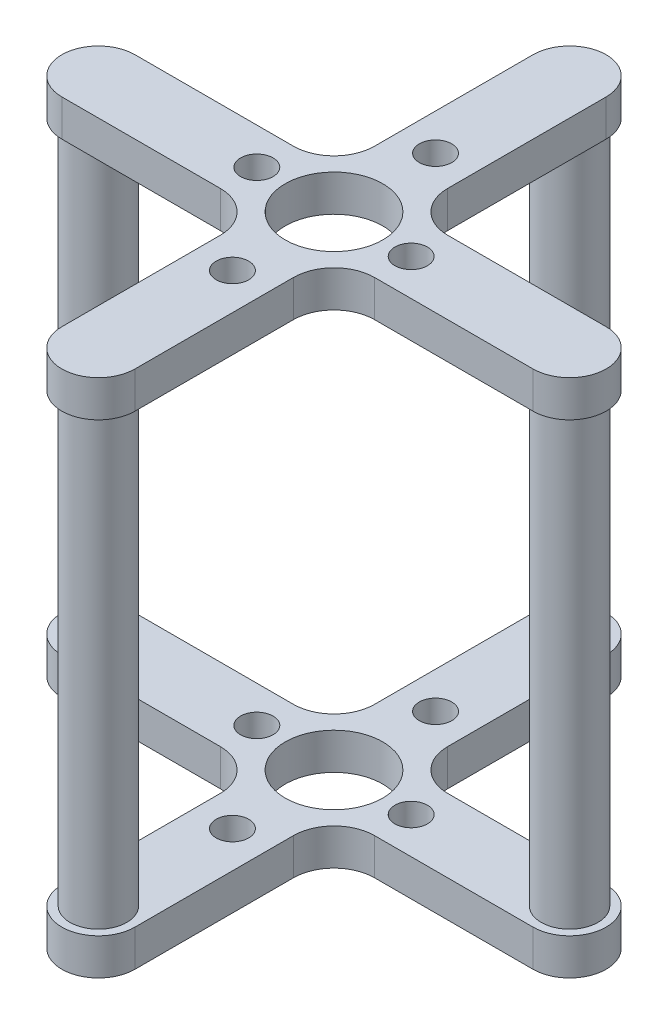
from build123d import *

# Parameters (mm, degrees)
BOSS_EXTRUDE1_DEPTH      = 4.5
SKETCH2_R                = 6
SKETCH2_R_2              = 2
SKETCH2_R_3              = 3.5
CUT_EXTRUDE1_DEPTH       = 48.589389574
FILLET1_R                = 5
BOSS_EXTRUDE2_DEPTH      = 27.5
BOSS_EXTRUDE2_DEPTH_BACK = 4.5
SKETCH4_R                = 3.5


with BuildPart() as part:
    # Sketch1 → Boss-Extrude1 (new body)
    with BuildSketch(Plane(origin=(0, 0, 0), x_dir=(1, 0, 0), z_dir=(0, 1, 0))):
        with BuildLine():
            Line((4.5, 4.5), (4.5, 29))
            ThreePointArc((4.5, 29), (0, 33.5), (-4.5, 29))
            Line((-4.5, 29), (-4.5, 4.5))
            Line((-4.5, 4.5), (-29, 4.5))
            ThreePointArc((-29, 4.5), (-33.5, 0), (-29, -4.5))
            Line((-29, -4.5), (-4.5, -4.5))
            Line((-4.5, -4.5), (-4.5, -29))
            ThreePointArc((-4.5, -29), (0, -33.5), (4.5, -29))
            Line((4.5, -29), (4.5, -4.5))
            Line((4.5, -4.5), (29, -4.5))
            ThreePointArc((29, -4.5), (33.5, 0), (29, 4.5))
            Line((29, 4.5), (4.5, 4.5))
        make_face()
    extrude(amount=BOSS_EXTRUDE1_DEPTH)

    # Sketch2 → Cut-Extrude1 (cut, through all)
    with BuildSketch(Plane(origin=(0, 4.5, 0), x_dir=(1, 0, 0), z_dir=(0, 1, 0))):
        Circle(SKETCH2_R)
        with Locations((9.5, 0)):
            Circle(SKETCH2_R_2)
        with Locations((29, 0)):
            Circle(SKETCH2_R_3)
        with Locations((0, 12.5)):
            Circle(SKETCH2_R_2)
        with Locations((0, -29)):
            Circle(SKETCH2_R_3)
        with Locations((-29, 0)):
            Circle(SKETCH2_R_3)
        with Locations((0, 29)):
            Circle(SKETCH2_R_3)
        with Locations((-9.5, 0)):
            Circle(SKETCH2_R_2)
        with Locations((0, -12.5)):
            Circle(SKETCH2_R_2)
    extrude(amount=-CUT_EXTRUDE1_DEPTH, mode=Mode.SUBTRACT)

    # Fillet1
    fillet1_edges = [part.edges().sort_by_distance(p)[0] for p in [
        (-4.5, 2.25, 4.5),
        (4.5, 2.25, 4.5),
        (4.5, 2.25, -4.5),
        (-4.5, 2.25, -4.5),
    ]]
    fillet(fillet1_edges, radius=FILLET1_R)

    # Sketch4 → Boss-Extrude2 (add, two sides: drawn at the far end of the back side and taken through both)
    with BuildSketch(Plane.XZ.offset(-BOSS_EXTRUDE2_DEPTH_BACK)):
        with Locations((0, -29)):
            Circle(SKETCH4_R)
        with Locations((-29, 0)):
            Circle(SKETCH4_R)
        with Locations((0, 29)):
            Circle(SKETCH4_R)
        with Locations((29, 0)):
            Circle(SKETCH4_R)
    extrude(amount=BOSS_EXTRUDE2_DEPTH + BOSS_EXTRUDE2_DEPTH_BACK)

    # Mirror2: part across plane


with BuildPart() as part_1:
    add(part.part)
    add(part.part.mirror(Plane(origin=(0, -27.5, 29), x_dir=(0, 0, 1), z_dir=(0, -1, 0))))


solid = part_1.part
